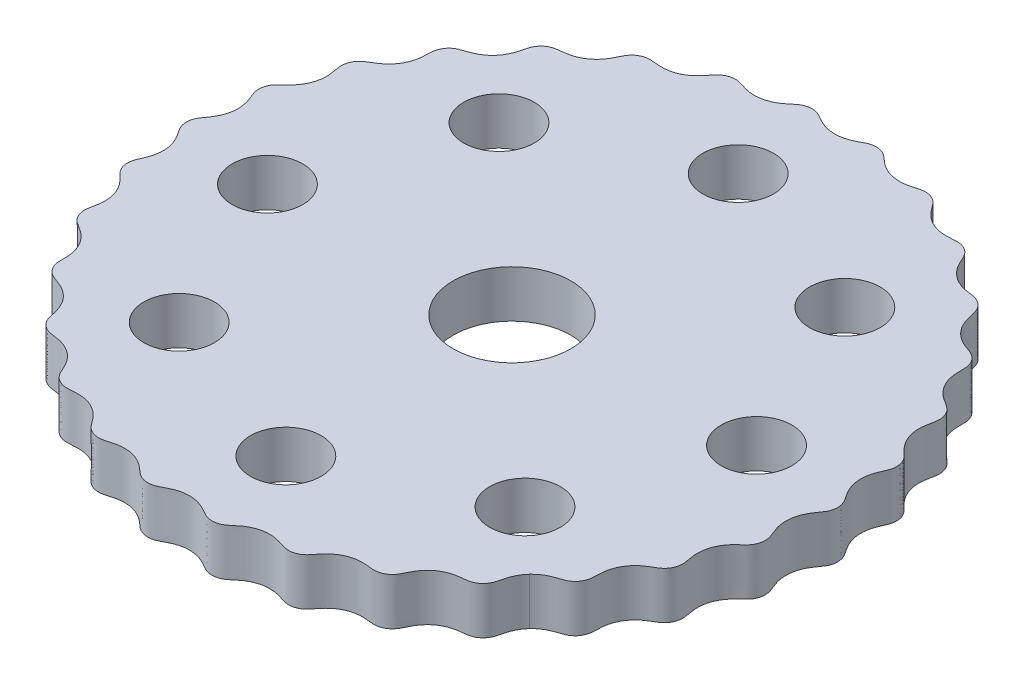
from build123d import *

# Parameters (mm, degrees)
BOSS_EXTRUDE1_DEPTH = 8
SKETCH3_R           = 10
SKETCH3_R_2         = 6
CUT_EXTRUDE1_DEPTH  = 81.434803792


with BuildPart() as part:
    # Boss-Extrude1: read off the stored shape, not the designer's step
    # Boss-Extrude1 outline → Boss-Extrude1 (new body)
    with BuildSketch(Plane(origin=(0, 0, 0), x_dir=(1, 0, 0), z_dir=(0, 1, 0))):
        with BuildLine():
            add(Edge.make_bspline(
                [(38.910952379, -35.98524399), (38.933800002, -35.960538792), (38.980181308, -35.911392776), (39.063871956, -35.825425723), (39.183047151, -35.708626319), (39.300608917, -35.599580217), (39.417028069, -35.497749268), (39.536040208, -35.399055184), (39.658360963, -35.302674229), (39.814781777, -35.18567925), (40.006949199, -35.05196701), (40.303199555, -34.863932989), (40.703592253, -34.644903083), (41.179443465, -34.429456108), (41.664075577, -34.251835203), (42.074986801, -34.11919037), (42.485410448, -33.98503667), (42.915215856, -33.827994553), (43.408663819, -33.566683982), (43.916271744, -33.13788368), (44.283944132, -32.654083589), (44.518168391, -32.184827396), (44.668446274, -31.716330841), (44.748054533, -31.267791378), (44.77096067, -30.763127866), (44.77983645, -30.208044058), (44.813164461, -29.615780671), (44.894380914, -28.990052313), (45.044382117, -28.338012032), (45.279599898, -27.671558592), (45.660242248, -26.897503425), (46.150361276, -26.197407691), (46.732659473, -25.587152598), (47.350168244, -25.096228204), (47.833077743, -24.774172953), (48.296910641, -24.50070747), (48.729064872, -24.256592519), (49.183225247, -23.966077561), (49.618285516, -23.577770453), (49.993719944, -23.075143787), (50.271875999, -22.465660294), (50.406497138, -21.847581006), (50.412788538, -21.254150774), (50.331270032, -20.708139399), (50.232877703, -20.205485712), (50.140787966, -19.661456702), (50.077816341, -19.073697623), (50.061973693, -18.27559313), (50.162431405, -17.442647423), (50.386373713, -16.634535395), (50.727037181, -15.872004701), (51.064638807, -15.297025666), (51.446441669, -14.781733838), (51.857488495, -14.323549971), (52.282837675, -13.914583549), (52.705626872, -13.5412336), (53.13831089, -13.13998944), (53.519067401, -12.652886041), (53.804613772, -12.066689012), (53.945147541, -11.486530896), (53.972974216, -10.97135897), (53.926270297, -10.488751466), (53.824149208, -10.051531478), (53.646841671, -9.586138167), (53.431685153, -9.083117095), (53.220859762, -8.537925521), (53.037068807, -7.943986268), (52.902346942, -7.298658013), (52.836164329, -6.605476926), (52.85368313, -5.748223525), (53.001021499, -4.907598924), (53.271675965, -4.105665086), (53.629883545, -3.392294419), (53.939989508, -2.889039819), (54.257520618, -2.437797976), (54.562913481, -2.026606619), (54.871761135, -1.56901955), (55.121804796, -1.030802549), (55.266666062, -0.415043048), (55.278299133, 0.25481195), (55.156102175, 0.8701594), (54.930837035, 1.408040041), (54.646195508, 1.865904497), (54.361417566, 2.272415261), (54.060700777, 2.719062532), (53.763707807, 3.21777741), (53.41802271, 3.926879394), (53.155533404, 4.72849178), (53.014939639, 5.571452861), (53.005007399, 6.433979637), (53.079936759, 7.13673952), (53.225554489, 7.789774697), (53.421903379, 8.389420308), (53.647047577, 8.938240155), (53.878232433, 9.442957649), (54.075034677, 9.908246207), (54.196476757, 10.347288454), (54.262758868, 10.83484549), (54.253676294, 11.35456716), (54.133433823, 11.940771354), (53.870417264, 12.532705884), (53.515216815, 13.025378074), (53.107023445, 13.43245648), (52.705952703, 13.804971668), (52.298010144, 14.212172981), (51.900235564, 14.667963304), (51.431247797, 15.3153162), (50.965250557, 16.195651509), (50.668882565, 17.150875756), (50.554743573, 18.140378609), (50.574945657, 18.939507524), (50.64487159, 19.540406611), (50.750682797, 20.107005193), (50.870462475, 20.641119473), (50.976549944, 21.207758713), (50.990502043, 21.814964197), (50.872273605, 22.451820685), (50.639588286, 23.003138325), (50.352896014, 23.436728765), (50.022280647, 23.801144344), (49.673653355, 24.094342792), (49.24804419, 24.366521884), (48.771772531, 24.651743836), (48.275517296, 24.976742225), (47.774231347, 25.359939608), (47.284547023, 25.815865944), (46.824991131, 26.352796445), (46.344960354, 27.0694704), (45.983719495, 27.843973483), (45.746371927, 28.653386251), (45.629973422, 29.433626671), (45.592520067, 30.012866205), (45.587608484, 30.551290121), (45.592275852, 31.047603959), (45.567762693, 31.586176201), (45.449009069, 32.157102501), (45.201438741, 32.733552449), (44.812688736, 33.279183053), (44.344726721, 33.704810191), (43.833947169, 34.006970315), (43.320327556, 34.209384962), (42.835821777, 34.375490117), (42.318631762, 34.567773563), (41.778135172, 34.807082319), (41.225709194, 35.111621503), (40.67595091, 35.494791785), (40.046854999, 36.045404161), (39.50568302, 36.684805408), (39.06718279, 37.397184013), (38.745508908, 38.138344569), (38.554212509, 38.723423694), (38.412724457, 39.296263687), (38.30078123, 39.849088599), (38.169639524, 40.424424032), (37.938171762, 40.997721652), (37.573284773, 41.538109901), (37.141119132, 41.949895229), (36.708880986, 42.231579556), (36.267578432, 42.432436663), (35.837874442, 42.562607126), (35.346178147, 42.641751016), (34.80297095, 42.706930501), (34.225408474, 42.796946156), (33.619146555, 42.934748118), (32.992914958, 43.140739674), (32.359511238, 43.430014362), (31.6258674, 43.873812765), (30.971534306, 44.421723814), (30.412366431, 45.057084372), (29.973673073, 45.723986578), (29.692894768, 46.244173531), (29.460873412, 46.744784472), (29.257467676, 47.214858143), (29.01560948, 47.711121611), (28.674521718, 48.196774297), (28.213688982, 48.630107599), (27.639394078, 48.975109643), (27.045389088, 49.176957707), (26.466938239, 49.250812707), (25.928095239, 49.233238154), (25.433657634, 49.189868606), (24.896491373, 49.15276386), (24.316095151, 49.144917831), (23.529152294, 49.200096728), (22.70369096, 49.373580486), (21.903368362, 49.673303225), (21.151432125, 50.095965018), (20.580288865, 50.512235683), (20.087552652, 50.964861925), (19.666418743, 51.434727862), (19.303698898, 51.904118389), (18.982193143, 52.356689106), (18.677642552, 52.759769143), (18.358141854, 53.084462211), (17.969046126, 53.385642738), (17.51441267, 53.637637844), (16.946623716, 53.826606916), (16.302485107, 53.89479517), (15.698218266, 53.833518671), (15.141581353, 53.683552061), (14.618438382, 53.522472208), (14.061820439, 53.372784242), (13.46820717, 53.256196504), (12.673089258, 53.173717615), (11.677697905, 53.210319789), (10.702265438, 53.431269671), (9.788261313, 53.827173806), (9.106296384, 54.244233777), (8.620865454, 54.605240956), (8.183082275, 54.980175445), (7.780415566, 55.350964839), (7.342735318, 55.726158922), (6.823855987, 56.041844559), (6.213207866, 56.257883987), (5.619410124, 56.332031421), (5.100563657, 56.30054386), (4.619662835, 56.196430356), (4.191431892, 56.041109505), (3.74291331, 55.808610716), (3.257768038, 55.538758342), (2.728183578, 55.271487897), (2.145681956, 55.028960217), (1.505996028, 54.83284431), (0.811222651, 54.703322467), (-0.049450582, 54.645940568), (-0.900810365, 54.720348321), (-1.720456189, 54.91950566), (-2.454363496, 55.208821799), (-2.974726346, 55.466006008), (-3.443470942, 55.730964413), (-3.870957662, 55.983163403), (-4.349631492, 56.231220517), (-4.903444997, 56.41384004), (-5.526450463, 56.487662822), (-6.193355438, 56.423810774), (-6.795940343, 56.231357335), (-7.313008475, 55.9400894), (-7.745114469, 55.596489027), (-8.131218693, 55.259947459), (-8.556335917, 54.908189203), (-9.03383186, 54.559760323), (-9.573783152, 54.233614117), (-10.180497989, 53.949095926), (-10.971889338, 53.679586794), (-11.796214633, 53.53062269), (-12.632400222, 53.507053312), (-13.435104598, 53.599064725), (-14.037440342, 53.725921994), (-14.604288827, 53.889836041), (-15.139003153, 54.069258237), (-15.702857303, 54.243424826), (-16.3150376, 54.329506241), (-16.96554224, 54.283878065), (-17.622010905, 54.090535601), (-18.195684041, 53.772763641), (-18.665672198, 53.360751937), (-19.034771591, 52.906703103), (-19.362919177, 52.469105435), (-19.729598352, 52.013783849), (-20.152104418, 51.557734987), (-20.643593046, 51.118345293), (-21.210825877, 50.714468532), (-21.961981515, 50.300996015), (-22.763657877, 50.008294836), (-23.593476995, 49.841713419), (-24.390379806, 49.795249581), (-24.981263067, 49.812179322), (-25.530816166, 49.861549938), (-26.039614455, 49.920431401), (-26.590320515, 49.959108251), (-27.181451877, 49.906543683), (-27.787145967, 49.724117645), (-28.373073922, 49.399264604), (-28.84488199, 48.985765298), (-29.198067714, 48.521739659), (-29.452269206, 48.046300688), (-29.661928889, 47.596420409), (-29.898378318, 47.112668384), (-30.181781618, 46.606107579), (-30.623039222, 45.952184397), (-31.186011413, 45.32405602), (-31.845739869, 44.780817309), (-32.587744289, 44.340952804), (-33.233816121, 44.054462677), (-33.872171452, 43.854055234), (-34.489651942, 43.724272961), (-35.077519854, 43.644847875), (-35.630203809, 43.5926937), (-36.131566841, 43.530496416), (-36.572495379, 43.416131485), (-37.027896608, 43.229780639), (-37.47734553, 42.959634504), (-37.931185268, 42.555397311), (-38.276421861, 42.074739991), (-38.483563908, 41.636522758), (-38.605702415, 41.270819819), (-38.681165938, 40.992892319), (-38.76560712, 40.6431001), (-38.866017283, 40.223156786), (-39.005140468, 39.726102909), (-39.182907268, 39.234922344), (-39.369984808, 38.818649221), (-39.534358579, 38.508639824), (-39.652666928, 38.306625704), (-39.757103262, 38.141554977), (-39.843648822, 38.012088558), (-39.932758499, 37.885740213), (-40.025197526, 37.761732192), (-40.124740547, 37.636022189), (-40.23188743, 37.508098866), (-40.311064007, 37.417957131), (-40.356442162, 37.367883381), (-40.379289784, 37.343178179)],
                knots=[0.068443104, 0.068443104, 0.068443104, 0.068443104, 0.068443104, 0.069168396, 0.069893682, 0.070618967, 0.071344253, 0.072069539, 0.072794824, 0.07352011, 0.074245396, 0.075695967, 0.077146538, 0.080047681, 0.082725296, 0.08540291, 0.086741718, 0.088080525, 0.09075814, 0.0939093, 0.09706046, 0.100336505, 0.101974527, 0.103612549, 0.106195374, 0.108778198, 0.111361023, 0.113943847, 0.117223149, 0.12050245, 0.123781752, 0.127061054, 0.13323211, 0.136317638, 0.139403166, 0.141712424, 0.144021682, 0.146330941, 0.148640199, 0.151722856, 0.154805513, 0.157908801, 0.161012089, 0.163395258, 0.165778427, 0.168161595, 0.170544764, 0.17365506, 0.176765356, 0.182985948, 0.186080541, 0.189175135, 0.192269729, 0.195364322, 0.197988813, 0.200613304, 0.203237795, 0.205862286, 0.208951272, 0.212040258, 0.215269092, 0.216883509, 0.218497927, 0.221043366, 0.223588805, 0.226134245, 0.228679684, 0.231910996, 0.235142307, 0.238373619, 0.241604931, 0.247825522, 0.250935817, 0.254046113, 0.256429281, 0.25881245, 0.261195618, 0.263578787, 0.266682074, 0.269785361, 0.272868019, 0.275950677, 0.278259935, 0.280569194, 0.282878452, 0.285187711, 0.288273239, 0.291358768, 0.297529825, 0.300809126, 0.304088427, 0.307367729, 0.31064703, 0.313229854, 0.315812678, 0.318395502, 0.320978327, 0.322616349, 0.324254371, 0.327530414, 0.330596438, 0.333662461, 0.336209483, 0.338756506, 0.341303529, 0.343850552, 0.346924845, 0.349999138, 0.356147724, 0.362296309, 0.365370602, 0.368444895, 0.370991917, 0.37353894, 0.376085962, 0.378632984, 0.381699007, 0.38476503, 0.388041074, 0.389679096, 0.391317119, 0.393899943, 0.396482768, 0.399065592, 0.401648417, 0.404927718, 0.40820702, 0.411486321, 0.414765623, 0.420936679, 0.424022207, 0.427107735, 0.429416994, 0.431726252, 0.43403551, 0.436344768, 0.439427426, 0.442510083, 0.445613371, 0.448716658, 0.451099827, 0.453482996, 0.455866165, 0.458249334, 0.46135963, 0.464469925, 0.467580221, 0.470690517, 0.476879704, 0.479974298, 0.483068892, 0.485693382, 0.488317873, 0.490942364, 0.493566855, 0.496655842, 0.499744828, 0.502973662, 0.504588079, 0.506202496, 0.508747935, 0.511293375, 0.513838814, 0.516384253, 0.519615565, 0.522846877, 0.526078188, 0.5293095, 0.535530091, 0.538640386, 0.541750682, 0.544133851, 0.546517019, 0.548900188, 0.551283357, 0.554386644, 0.557489931, 0.560572589, 0.563655246, 0.565964505, 0.568273763, 0.570583022, 0.57289228, 0.575977809, 0.579063337, 0.585234394, 0.588513695, 0.591792997, 0.595072298, 0.598351599, 0.600934423, 0.603517248, 0.606100072, 0.608682896, 0.610320918, 0.61195894, 0.615234984, 0.618301007, 0.62136703, 0.623914053, 0.626461076, 0.629008098, 0.631555121, 0.634629414, 0.637703707, 0.643852293, 0.650000878, 0.653075171, 0.656149464, 0.658696487, 0.661243509, 0.663790532, 0.666337554, 0.669403577, 0.6724696, 0.675745644, 0.677383666, 0.679021688, 0.681604513, 0.684187337, 0.686770162, 0.689352986, 0.692632287, 0.695911589, 0.69919089, 0.702470192, 0.708641248, 0.711726776, 0.714812305, 0.717121563, 0.719430821, 0.72174008, 0.724049338, 0.727131996, 0.730214653, 0.73331794, 0.736421228, 0.738804397, 0.741187566, 0.743570734, 0.745953903, 0.749064199, 0.752174494, 0.75528479, 0.758395086, 0.764584273, 0.767678867, 0.770773461, 0.773397952, 0.776022443, 0.778646934, 0.781271425, 0.784360411, 0.787449398, 0.790678232, 0.793907066, 0.796452505, 0.798997944, 0.801543383, 0.804088823, 0.807320134, 0.810551446, 0.813782757, 0.817014069, 0.82323466, 0.826344956, 0.829455251, 0.83183842, 0.834221589, 0.836604757, 0.838987926, 0.842091214, 0.845194501, 0.848277159, 0.851359816, 0.853669075, 0.855978333, 0.858287591, 0.86059685, 0.863682378, 0.866767906, 0.872938963, 0.876218264, 0.879497566, 0.882776867, 0.886056168, 0.888638993, 0.891221817, 0.893804642, 0.896387466, 0.898025488, 0.89966351, 0.902939554, 0.906090715, 0.909241875, 0.910580683, 0.91191949, 0.913258297, 0.914597105, 0.91727472, 0.919952335, 0.922853478, 0.924304049, 0.925754621, 0.926479906, 0.927205192, 0.927930478, 0.928655764, 0.929381049, 0.930106335, 0.930831621, 0.931556904, 0.931556904, 0.931556904, 0.931556904, 0.931556904], degree=4))
            add(Edge.make_bspline(
                [(-40.379289784, 37.343178179), (-40.402137325, 37.318473071), (-40.448518579, 37.269327105), (-40.532209128, 37.183360131), (-40.651384215, 37.066560824), (-40.768945998, 36.957514756), (-40.885365155, 36.855683802), (-41.004377219, 36.75698949), (-41.126697877, 36.660608246), (-41.283118725, 36.543613327), (-41.475288261, 36.409906785), (-41.771530516, 36.221850704), (-42.171941608, 36.002870622), (-42.64775819, 35.787329531), (-43.132444697, 35.609856133), (-43.543275542, 35.476993025), (-43.885414767, 35.36552258), (-44.156608593, 35.268608457), (-44.511669364, 35.118314398), (-44.932392505, 34.877619136), (-45.384653933, 34.495939474), (-45.752256197, 34.011948987), (-45.986518532, 33.542796106), (-46.136776598, 33.074245755), (-46.216397094, 32.625739468), (-46.239294539, 32.121052338), (-46.24817604, 31.565984116), (-46.28150072, 30.973711803), (-46.362719119, 30.347988889), (-46.512719072, 29.695945419), (-46.747937443, 29.029493829), (-47.128579314, 28.255437559), (-47.618698563, 27.555342527), (-48.200996555, 26.945086848), (-48.818505456, 26.45416266), (-49.301414924, 26.13210719), (-49.765247891, 25.858641776), (-50.197402143, 25.614526739), (-50.651562586, 25.324011843), (-51.086622919, 24.935704676), (-51.462057399, 24.433078094), (-51.740213483, 23.823594493), (-51.874834661, 23.20551543), (-51.881126099, 22.612084947), (-51.799607652, 22.066074136), (-51.701215301, 21.563419512), (-51.609125615, 21.019392347), (-51.546153866, 20.431630317), (-51.530311354, 19.633531331), (-51.631652657, 18.793246214), (-51.860924762, 17.97117975), (-52.214541202, 17.190058934), (-52.572938567, 16.593049009), (-52.972649301, 16.068782183), (-53.394349626, 15.611988164), (-53.819679833, 15.210907649), (-54.230345901, 14.849623914), (-54.654218439, 14.446229842), (-55.028311817, 13.94553367), (-55.300364372, 13.348819926), (-55.441907889, 12.679269443), (-55.436652485, 12.027187701), (-55.303078447, 11.423587915), (-55.085457479, 10.875038357), (-54.864870056, 10.355949806), (-54.657236806, 9.803615258), (-54.483779121, 9.213010866), (-54.329430762, 8.419930165), (-54.287699186, 7.584454056), (-54.371905423, 6.751020311), (-54.578858466, 5.941016682), (-54.815181069, 5.313955982), (-55.098212923, 4.750208064), (-55.408331564, 4.246986952), (-55.725855393, 3.795725229), (-56.031252227, 3.384544645), (-56.340097854, 2.926951828), (-56.590142789, 2.388738122), (-56.735003353, 1.772976552), (-56.74663693, 1.103122845), (-56.624439721, 0.487774605), (-56.399174827, -0.050105508), (-56.114533239, -0.507970263), (-55.8297554, -0.91448079), (-55.529038584, -1.361128133), (-55.232045639, -1.859842885), (-54.886360512, -2.568944821), (-54.623871159, -3.370557111), (-54.483277307, -4.213518179), (-54.473344986, -5.076044958), (-54.548274289, -5.778804912), (-54.693891985, -6.431840151), (-54.890240856, -7.031485826), (-55.115385055, -7.580305724), (-55.346569925, -8.085023263), (-55.54337221, -8.550311847), (-55.664814336, -8.98935412), (-55.731096487, -9.476911192), (-55.722013943, -9.996632878), (-55.601771505, -10.582837072), (-55.338754993, -11.174771592), (-54.983554616, -11.667443768), (-54.575361305, -12.074522164), (-54.174290597, -12.447037318), (-53.766348059, -12.854238581), (-53.368573489, -13.310028842), (-52.899585717, -13.957381647), (-52.433588409, -14.837716887), (-52.137220325, -15.792941105), (-52.023081239, -16.782443977), (-52.043283267, -17.581572964), (-52.113209172, -18.182472108), (-52.219020369, -18.749070743), (-52.338800055, -19.28318507), (-52.444887567, -19.849824353), (-52.458839718, -20.457029888), (-52.340611313, -21.09388641), (-52.107926022, -21.645204069), (-51.821233784, -22.078794513), (-51.49061847, -22.443210086), (-51.14199123, -22.736408538), (-50.716382114, -23.008587631), (-50.240110492, -23.293809556), (-49.743855286, -23.618807901), (-49.242569358, -24.002005221), (-48.752885041, -24.457931487), (-48.293329143, -24.994861898), (-47.8132983, -25.711535804), (-47.452057363, -26.486038848), (-47.214709702, -27.29545167), (-47.098311144, -28.075692112), (-47.060857738, -28.654931765), (-47.055946173, -29.193355605), (-47.060613494, -29.689669698), (-47.03610045, -30.228241656), (-46.917346736, -30.799168536), (-46.669776639, -31.37561768), (-46.281026333, -31.921249651), (-45.813064891, -32.346874661), (-45.302284557, -32.649038264), (-44.78866647, -32.851446954), (-44.304157972, -33.017563371), (-43.786973012, -33.209826059), (-43.246468263, -33.449170036), (-42.54737671, -33.8345029), (-41.87033272, -34.342403662), (-41.27304811, -34.952001408), (-40.77337202, -35.648789832), (-40.435568296, -36.257697676), (-40.181353402, -36.865952), (-39.996678104, -37.459616829), (-39.86188228, -38.028397381), (-39.75452693, -38.564864765), (-39.637267988, -39.048888878), (-39.473973857, -39.467129114), (-39.239303703, -39.89141845), (-38.924759727, -40.300365833), (-38.480516858, -40.699092019), (-37.913311225, -41.020712516), (-37.323704266, -41.206753157), (-36.739891936, -41.292614497), (-36.180019164, -41.361091861), (-35.597887571, -41.457462683), (-34.999668695, -41.602535322), (-34.235673528, -41.865412557), (-33.49125922, -42.24700536), (-32.811590676, -42.736649859), (-32.213581673, -43.320876601), (-31.788693491, -43.839069295), (-31.441988694, -44.366055405), (-31.161246139, -44.886236972), (-30.929203694, -45.386851333), (-30.725809399, -45.856923171), (-30.483945145, -46.353187696), (-30.142860912, -46.838839874), (-29.68202601, -47.27217358), (-29.107732492, -47.617175432), (-28.513726683, -47.819023664), (-27.935276418, -47.892878619), (-27.396433126, -47.875304159), (-26.90199578, -47.831934584), (-26.364829441, -47.794829849), (-25.784433343, -47.78698378), (-24.997490511, -47.842162626), (-24.172029238, -48.015646295), (-23.371706608, -48.315368952), (-22.619770326, -48.738030677), (-22.048626977, -49.154301328), (-21.555890694, -49.606927572), (-21.134756721, -50.076793525), (-20.77203683, -50.546184078), (-20.450531044, -50.998754829), (-20.145980451, -51.401834916), (-19.826479752, -51.726528035), (-19.437384013, -52.027708615), (-18.982750559, -52.279703755), (-18.414961623, -52.468672856), (-17.770823045, -52.536861146), (-17.166556252, -52.475584702), (-16.609919377, -52.325618138), (-16.086776452, -52.164538296), (-15.530158563, -52.014850325), (-14.936545353, -51.898262564), (-14.141427517, -51.815783625), (-13.146036191, -51.852385707), (-12.170603702, -52.073335493), (-11.256599513, -52.469239557), (-10.574634494, -52.886299516), (-10.089203501, -53.247306699), (-9.651420271, -53.622241206), (-9.248753525, -53.99303063), (-8.811073263, -54.368224771), (-8.292193913, -54.683910479), (-7.681545778, -54.899949953), (-7.087748034, -54.97409742), (-6.56890158, -54.942609891), (-6.08800079, -54.83849643), (-5.65976987, -54.683175625), (-5.211251311, -54.450676879), (-4.726106082, -54.180824523), (-4.196521674, -53.913554083), (-3.614020117, -53.671026389), (-2.974334252, -53.474910454), (-2.279560951, -53.345388559), (-1.418887728, -53.288006579), (-0.567527939, -53.362414245), (0.252117978, -53.561571531), (0.98602533, -53.850887635), (1.506388308, -54.10807186), (1.97513283, -54.373030242), (2.402619795, -54.625229316), (2.881293322, -54.873286394), (3.435107372, -55.05590612), (4.058112031, -55.129728713), (4.725018332, -55.06587707), (5.32760112, -54.873423092), (5.844672636, -54.582156171), (6.276772742, -54.238554224), (6.662888016, -53.902015775), (7.087984853, -53.550251811), (7.56551517, -53.201832958), (8.248768966, -52.789068341), (9.027145898, -52.456681409), (9.853715328, -52.24421661), (10.706989846, -52.159878604), (11.403221398, -52.1717859), (12.057092545, -52.255756492), (12.663559066, -52.392655398), (13.223535356, -52.560309066), (13.741807511, -52.735570299), (14.219614045, -52.87603315), (14.663467966, -52.943736411), (15.148248115, -52.952650784), (15.659679474, -52.884721394), (16.227106943, -52.699358918), (16.789242785, -52.368954648), (17.245159813, -51.951360461), (17.61142848, -51.488694707), (17.950659811, -51.038069593), (18.325199382, -50.582113928), (18.749922119, -50.136577682), (19.233860054, -49.715741409), (19.780751362, -49.334315604), (20.514383963, -48.935206764), (21.302564177, -48.648907697), (22.125135178, -48.483779712), (22.922043489, -48.437315581), (23.512923799, -48.454245428), (24.062478741, -48.50361595), (24.571276095, -48.562497464), (25.121982721, -48.601174329), (25.713113836, -48.548609819), (26.318808153, -48.366183803), (26.904736003, -48.041330798), (27.376544159, -47.627831538), (27.72972983, -47.163805967), (27.983931387, -46.68836706), (28.193590986, -46.238486808), (28.430040491, -45.754734847), (28.71344357, -45.248174028), (29.154701389, -44.594250959), (29.717672979, -43.966122423), (30.377402152, -43.422883878), (31.119405436, -42.983018982), (31.765479158, -42.696529299), (32.403831213, -42.496120858), (33.021317282, -42.3663401), (33.609176035, -42.286912391), (34.161875975, -42.234762703), (34.663214783, -42.172558596), (35.10417735, -42.058203277), (35.559523402, -41.87183687), (36.009078291, -41.601720635), (36.462722743, -41.197428385), (36.850618919, -40.657917438), (37.07264034, -40.145588837), (37.195675665, -39.704842625), (37.297404252, -39.285204591), (37.397590536, -38.865198168), (37.536865021, -38.368187014), (37.71453529, -37.876979267), (37.901663937, -37.460720596), (38.066015084, -37.150704842), (38.184329279, -36.948692387), (38.288765674, -36.783621688), (38.375310939, -36.654155195), (38.464420382, -36.527806794), (38.556859405, -36.403798777), (38.65640246, -36.278088789), (38.763549333, -36.150165469), (38.842725885, -36.060023734), (38.888104029, -36.009949983), (38.910952379, -35.98524399)],
                knots=[0.068443105, 0.068443105, 0.068443105, 0.068443105, 0.068443105, 0.069168387, 0.069893673, 0.070618959, 0.071344245, 0.07206953, 0.072794816, 0.073520102, 0.074245388, 0.075695959, 0.077146531, 0.080047674, 0.082725289, 0.085402903, 0.086741711, 0.088080518, 0.089419326, 0.090758133, 0.093909294, 0.097060454, 0.100336498, 0.10197452, 0.103612542, 0.106195367, 0.108778191, 0.111361016, 0.11394384, 0.117223141, 0.120502443, 0.123781744, 0.127061045, 0.133232102, 0.13631763, 0.139403159, 0.141712417, 0.144021675, 0.146330934, 0.148640192, 0.15172285, 0.154805507, 0.157908795, 0.161012082, 0.163395251, 0.16577842, 0.168161588, 0.170544757, 0.173655053, 0.176765348, 0.182985939, 0.186217251, 0.189448562, 0.192679874, 0.195911186, 0.198456625, 0.201002064, 0.203547503, 0.206092942, 0.209321777, 0.212550611, 0.215639597, 0.218728583, 0.221353074, 0.223977565, 0.226602056, 0.229226547, 0.232321141, 0.235415735, 0.241604922, 0.244715218, 0.247825514, 0.25093581, 0.254046105, 0.256429274, 0.258812443, 0.261195612, 0.26357878, 0.266682068, 0.269785355, 0.272868013, 0.27595067, 0.278259929, 0.280569187, 0.282878445, 0.285187704, 0.288273232, 0.29135876, 0.297529817, 0.300809118, 0.304088419, 0.307367721, 0.310647022, 0.313229847, 0.315812671, 0.318395496, 0.32097832, 0.322616342, 0.324254364, 0.327530408, 0.330596431, 0.333662454, 0.336209477, 0.338756499, 0.341303522, 0.343850544, 0.346924837, 0.34999913, 0.356147715, 0.362296301, 0.365370594, 0.368444887, 0.37099191, 0.373538933, 0.376085955, 0.378632978, 0.381699001, 0.384765024, 0.388041068, 0.38967909, 0.391317112, 0.393899936, 0.396482761, 0.399065585, 0.401648409, 0.40492771, 0.408207012, 0.411486313, 0.414765614, 0.420936671, 0.4240222, 0.427107728, 0.429416986, 0.431726245, 0.434035503, 0.436344762, 0.439427419, 0.442510077, 0.445613364, 0.448716652, 0.45109982, 0.453482989, 0.455866158, 0.458249326, 0.461359622, 0.464469917, 0.470690508, 0.47392182, 0.477153132, 0.480384443, 0.483615755, 0.486161194, 0.488706634, 0.491252073, 0.493797512, 0.495411929, 0.497026346, 0.500255181, 0.503344167, 0.506433153, 0.509057644, 0.511682135, 0.514306626, 0.516931117, 0.52002571, 0.523120304, 0.529309491, 0.532419787, 0.535530083, 0.538640379, 0.541750675, 0.544133843, 0.546517012, 0.548900181, 0.55128335, 0.554386638, 0.557489925, 0.560572583, 0.56365524, 0.565964498, 0.568273756, 0.570583015, 0.572892273, 0.575977801, 0.579063329, 0.585234386, 0.588513687, 0.591792989, 0.59507229, 0.598351592, 0.600934416, 0.603517241, 0.606100065, 0.60868289, 0.610320912, 0.611958934, 0.615234978, 0.618301001, 0.621367024, 0.623914046, 0.626461069, 0.629008091, 0.631555114, 0.634629406, 0.637703699, 0.643852284, 0.65000087, 0.653075164, 0.656149457, 0.658696479, 0.661243502, 0.663790525, 0.666337548, 0.669403571, 0.672469594, 0.675745638, 0.67738366, 0.679021682, 0.681604506, 0.68418733, 0.686770154, 0.689352979, 0.69263228, 0.695911581, 0.699190882, 0.702470183, 0.70864124, 0.711726769, 0.714812297, 0.717121556, 0.719430814, 0.721740073, 0.724049331, 0.727131989, 0.730214647, 0.733317934, 0.736421221, 0.73880439, 0.741187559, 0.743570727, 0.745953896, 0.749064191, 0.752174487, 0.758395077, 0.761626389, 0.764857701, 0.768089013, 0.771320324, 0.773865764, 0.776411203, 0.778956642, 0.781502082, 0.783116499, 0.784730916, 0.78795975, 0.791048737, 0.794137723, 0.796762213, 0.799386704, 0.802011195, 0.804635686, 0.80773028, 0.810824873, 0.813919467, 0.81701406, 0.823234652, 0.826344948, 0.829455244, 0.831838413, 0.834221582, 0.836604751, 0.83898792, 0.842091207, 0.845194495, 0.848277152, 0.85135981, 0.853669068, 0.855978326, 0.858287584, 0.860596842, 0.86368237, 0.866767898, 0.872938955, 0.876218256, 0.879497558, 0.882776859, 0.886056161, 0.888638986, 0.89122181, 0.893804635, 0.896387459, 0.898025482, 0.899663504, 0.902939548, 0.906090708, 0.909241869, 0.911919483, 0.913258291, 0.914597098, 0.917274713, 0.919952327, 0.92285347, 0.924304041, 0.925754613, 0.926479898, 0.927205184, 0.92793047, 0.928655755, 0.929381041, 0.930106327, 0.930831612, 0.931556898, 0.931556898, 0.931556898, 0.931556898, 0.931556898], degree=4))
        make_face()
    extrude(amount=BOSS_EXTRUDE1_DEPTH)

    # Sketch3 → Cut-Extrude1 (cut, through all)
    with BuildSketch(Plane(origin=(0, 8, 0), x_dir=(1, 0, 0), z_dir=(0, 1, 0))):
        with Locations(Location((-0.734168899, 0.678966883, 0), (0, 0, 270))):
            Circle(SKETCH3_R)
        with Locations(Location((-27.892844205, -28.687789077, 0), (0, 0, 270))):
            Circle(SKETCH3_R_2)
        with Locations(Location((-40.703684657, -0.882381921, 0), (0, 0, 270))):
            Circle(SKETCH3_R_2)
        with Locations(Location((-30.100924859, 27.837642189, 0), (0, 0, 270))):
            Circle(SKETCH3_R_2)
        with Locations(Location((-2.295517702, 40.64848264, 0), (0, 0, 270))):
            Circle(SKETCH3_R_2)
        with Locations(Location((26.424506407, 30.045722842, 0), (0, 0, 270))):
            Circle(SKETCH3_R_2)
        with Locations(Location((39.235346859, 2.240315686, 0), (0, 0, 270))):
            Circle(SKETCH3_R_2)
        with Locations(Location((28.632587061, -26.479708424, 0), (0, 0, 270))):
            Circle(SKETCH3_R_2)
        with Locations(Location((0.827179904, -39.290548875, 0), (0, 0, 270))):
            Circle(SKETCH3_R_2)
    extrude(amount=-CUT_EXTRUDE1_DEPTH, mode=Mode.SUBTRACT)


solid = part.part
